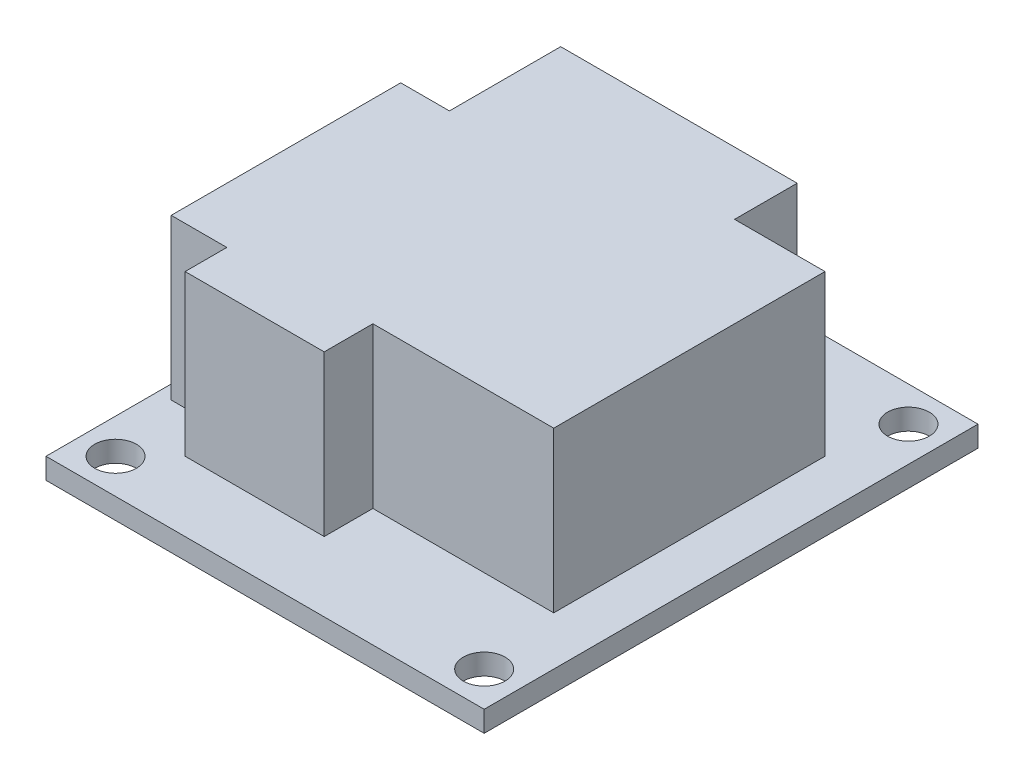
from build123d import *

# Parameters (mm, degrees)
SKETCH1_W           = 31.5
SKETCH1_H           = 35.5
SKETCH1_R           = 1.5
BOSS_EXTRUDE1_DEPTH = 1.5
BOSS_EXTRUDE2_DEPTH = 13
BOSS_EXTRUDE3_DEPTH = 1


with BuildPart() as part:
    # Sketch1 → Boss-Extrude1 (new body)
    with BuildSketch(Plane(origin=(1.504255695, 0, 3.099567369), x_dir=(1, 0, 0), z_dir=(0, 1, 0))):
        with Locations((0, -24.5)):
            Rectangle(SKETCH1_W, SKETCH1_H)
        with Locations((-13.25, -39.75)):
            Circle(SKETCH1_R, mode=Mode.SUBTRACT)
        with Locations((13.25, -39.75)):
            Circle(SKETCH1_R, mode=Mode.SUBTRACT)
        with Locations((-13.25, -9.25)):
            Circle(SKETCH1_R, mode=Mode.SUBTRACT)
        with Locations((13.25, -9.25)):
            Circle(SKETCH1_R, mode=Mode.SUBTRACT)
    extrude(amount=BOSS_EXTRUDE1_DEPTH)

    # Sketch1<3> → Boss-Extrude2 (add)
    with BuildSketch(Plane(origin=(1.504255695, 0, 3.099567369), x_dir=(1, 0, 0), z_dir=(0, 1, 0))):
        Polygon((-11.25, -9.75), (-11.25, -17.75), (-14.75, -17.75), (-14.75, -34.25), (-10.75, -34.25), (-10.75, -37.25), (-0.75, -37.25), (-0.75, -33.75), (12.25, -33.75), (12.25, -14.25), (5.75, -14.25), (5.75, -9.75), align=None)
    extrude(amount=BOSS_EXTRUDE2_DEPTH)

    # Sketch1<4> → Boss-Extrude3 (add)
    with BuildSketch(Plane(origin=(1.504255695, 0, 3.099567369), x_dir=(1, 0, 0), z_dir=(0, 1, 0))):
        Polygon((-11.25, -9.75), (-11.25, -17.75), (-14.75, -17.75), (-14.75, -34.25), (-10.75, -34.25), (-10.75, -37.25), (-0.75, -37.25), (-0.75, -33.75), (12.25, -33.75), (12.25, -14.25), (5.75, -14.25), (5.75, -9.75), align=None)
    extrude(amount=-BOSS_EXTRUDE3_DEPTH)


solid = part.part
